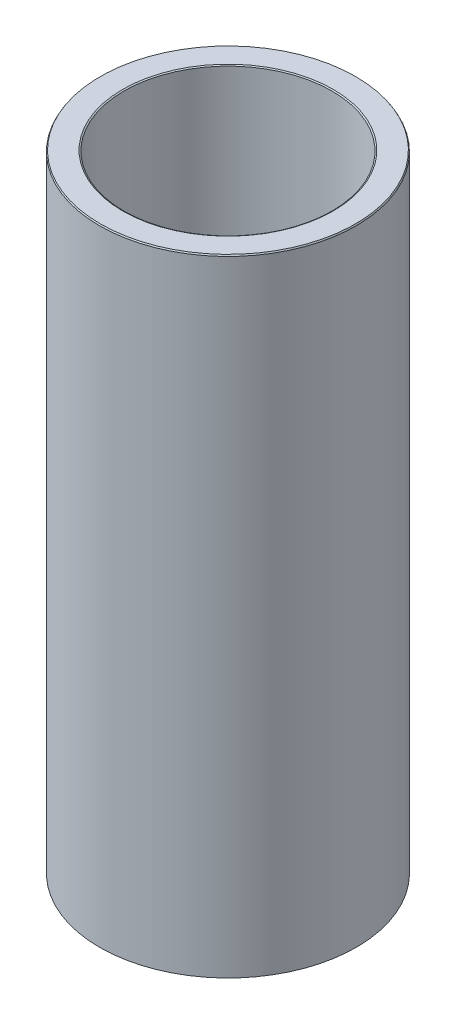
from build123d import *
from OCP.BRepFilletAPI import BRepFilletAPI_MakeChamfer

# Parameters (mm, degrees)
SKETCH1_R           = 52.5
BOSS_EXTRUDE1_DEPTH = 256.403338461
SKETCH2_R           = 42.541524939
CUT_EXTRUDE1_DEPTH  = 267.936644119
CHAMFER1_SIZE       = 0.528411966
CHAMFER1_SIZE2      = 0.305078791


with BuildPart() as part:
    # Sketch1 → Boss-Extrude1 (new body)
    with BuildSketch(Plane(origin=(0, 0, 0), x_dir=(1, 0, 0), z_dir=(0, 1, 0))):
        Circle(SKETCH1_R)
    extrude(amount=BOSS_EXTRUDE1_DEPTH)

    # Sketch2 → Cut-Extrude1 (cut, through all)
    with BuildSketch(Plane(origin=(0, 0, 0), x_dir=(1, 0, 0), z_dir=(0, 1, 0))):
        Circle(SKETCH2_R)
    extrude(amount=CUT_EXTRUDE1_DEPTH, mode=Mode.SUBTRACT)

    # Chamfer1: one chamfer whose edges measure the first distance from different faces: ONE call of the kernel's chamfer builder (chamfer() names one face for all edges)
    chamfer1_edges_1 = [part.edges().sort_by_distance(p)[0] for p in [
        (-42.541524939, 256.403338461, 0),
    ]]
    chamfer1_side_1 = [part.faces().sort_by_distance(p)[0] for p in [
        (-51.01507576, 256.403338461, 0),
    ]]
    chamfer1_edges_2 = [part.edges().sort_by_distance(p)[0] for p in [
        (-42.541524939, 0, 0),
    ]]
    chamfer1_side_2 = [part.faces().sort_by_distance(p)[0] for p in [
        (-42.541524939, 128.20166923, 0),
    ]]
    chamfer1_edges_3 = [part.edges().sort_by_distance(p)[0] for p in [
        (-52.5, 0, 0),
    ]]
    chamfer1_side_3 = [part.faces().sort_by_distance(p)[0] for p in [
        (-51.01507576, 0, 0),
    ]]
    chamfer1_edges_4 = [part.edges().sort_by_distance(p)[0] for p in [
        (-52.5, 256.403338461, 0),
    ]]
    chamfer1_side_4 = [part.faces().sort_by_distance(p)[0] for p in [
        (-52.5, 128.20166923, 0),
    ]]
    chamfer1 = BRepFilletAPI_MakeChamfer(part.part.solid().wrapped)
    for e in chamfer1_edges_1:
        chamfer1.Add(CHAMFER1_SIZE, CHAMFER1_SIZE2, e.wrapped, chamfer1_side_1[0].wrapped)  # the first distance lies on this face
    for e in chamfer1_edges_2:
        chamfer1.Add(CHAMFER1_SIZE, CHAMFER1_SIZE2, e.wrapped, chamfer1_side_2[0].wrapped)  # the first distance lies on this face
    for e in chamfer1_edges_3:
        chamfer1.Add(CHAMFER1_SIZE, CHAMFER1_SIZE2, e.wrapped, chamfer1_side_3[0].wrapped)  # the first distance lies on this face
    for e in chamfer1_edges_4:
        chamfer1.Add(CHAMFER1_SIZE, CHAMFER1_SIZE2, e.wrapped, chamfer1_side_4[0].wrapped)  # the first distance lies on this face
    add(Compound.cast(chamfer1.Shape()), mode=Mode.REPLACE)


solid = part.part
